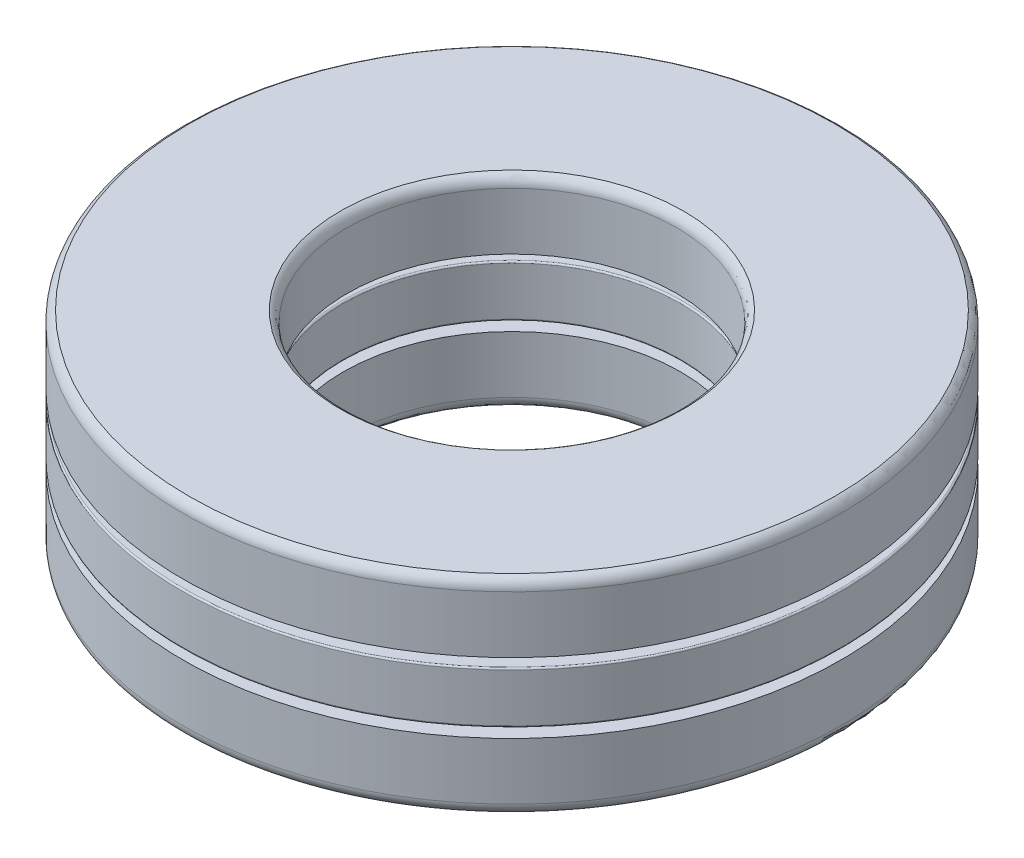
from build123d import *

# Parameters (mm, degrees)
CIRPATTERN1_COUNT = 10
CIRPATTERN2_COUNT = 10


# Read off the part's stored shape, not the designer's step: Cut-Revolve1
with BuildPart() as part:
    # Sketch3 → Revolve1 (revolve)
    with BuildSketch(Plane(origin=(0, 0, 0), x_dir=(0, 0, -1), z_dir=(1, 0, 0))):
        with BuildLine():
            Line((8, 0.85), (7.24012867, 0.85))
            ThreePointArc((7.24012867, 0.85), (6.05, 1.4625), (4.85987133, 0.85))
            Line((4.85987133, 0.85), (4, 0.85))
            Line((4, 0.85), (4, 2.232091434))
            ThreePointArc((4, 2.232091434), (4.044559205, 2.389412761), (4.165, 2.5))
            Line((4.165, 2.5), (7.835, 2.5))
            ThreePointArc((7.835, 2.5), (7.955440795, 2.389412761), (8, 2.232091434))
            Line((8, 2.232091434), (8, 0.85))
        make_face()
        with BuildLine():
            Line((4.85987133, -0.85), (4.1, -0.85))
            Line((4.1, -0.85), (4.1, -2.232091434))
            ThreePointArc((4.1, -2.232091434), (4.144559205, -2.389412761), (4.265, -2.5))
            Line((4.265, -2.5), (7.835, -2.5))
            ThreePointArc((7.835, -2.5), (7.955440795, -2.389412761), (8, -2.232091434))
            Line((8, -2.232091434), (8, -0.85))
            Line((8, -0.85), (7.24012867, -0.85))
            ThreePointArc((7.24012867, -0.85), (6.05, -1.4625), (4.85987133, -0.85))
        make_face()
        with BuildLine():
            Line((7.9625, 0.625), (4.1375, 0.625))
            ThreePointArc((4.1375, 0.625), (4.110983496, 0.614016504), (4.1, 0.5875))
            Line((4.1, 0.5875), (4.1, -0.5875))
            ThreePointArc((4.1, -0.5875), (4.110983496, -0.614016504), (4.1375, -0.625))
            Line((4.1375, -0.625), (7.9625, -0.625))
            ThreePointArc((7.9625, -0.625), (7.989016504, -0.614016504), (8, -0.5875))
            Line((8, -0.5875), (8, 0.5875))
            ThreePointArc((8, 0.5875), (7.989016504, 0.614016504), (7.9625, 0.625))
        make_face()
    revolve(axis=Axis((0, -2.5, 0), (0, 1, 0)))

    # Cut-Revolve1 outline → Cut-Revolve1 (revolve, cut)
    with BuildSketch(Plane.XY.offset(-6.05)):
        with BuildLine():
            Line((1.402682836, 0.625000001), (0, 0.625000001))
            Line((0, 0.625000001), (0, -0.625000001))
            Line((0, -0.625000001), (1.402682836, -0.625000001))
            ThreePointArc((1.402682836, -0.625000001), (1.535625, 0), (1.402682836, 0.625000001))
        make_face()
    cut_revolve1 = revolve(axis=Axis((0, 0, -6.05), (0, 1, 0)), mode=Mode.SUBTRACT)

    # CirPattern2: Cut-Revolve1 ×10 about axis
    cirpattern2_axis = Axis((0, 0, 0), (0, 1, 0))
    for i in range(1, CIRPATTERN2_COUNT):
        add(cut_revolve1.rotate(cirpattern2_axis, i * 360 / CIRPATTERN2_COUNT), mode=Mode.SUBTRACT)


with BuildPart() as body_2:
    # Sketch4 → Revolve2 (revolve)
    with BuildSketch(Plane(origin=(0, 0, 0), x_dir=(0, 0, -1), z_dir=(1, 0, 0))):
        with BuildLine():
            Line((6.05, -1.4625), (6.05, 1.4625))
            ThreePointArc((6.05, 1.4625), (4.5875, 0), (6.05, -1.4625))
        make_face()
    revolve(axis=Axis((0, 2.5, -6.05), (0, -1, 0)))


with BuildPart() as cirpattern1_1:
    # CirPattern1: pattern copy
    add(body_2.part.rotate(Axis((0, 0, 0), (0, 1, 0)), 1 * 360 / CIRPATTERN1_COUNT))


with BuildPart() as cirpattern1_2:
    # CirPattern1: pattern copy
    add(body_2.part.rotate(Axis((0, 0, 0), (0, 1, 0)), 2 * 360 / CIRPATTERN1_COUNT))


with BuildPart() as cirpattern1_3:
    # CirPattern1: pattern copy
    add(body_2.part.rotate(Axis((0, 0, 0), (0, 1, 0)), 3 * 360 / CIRPATTERN1_COUNT))


with BuildPart() as cirpattern1_4:
    # CirPattern1: pattern copy
    add(body_2.part.rotate(Axis((0, 0, 0), (0, 1, 0)), 4 * 360 / CIRPATTERN1_COUNT))


with BuildPart() as cirpattern1_5:
    # CirPattern1: pattern copy
    add(body_2.part.rotate(Axis((0, 0, 0), (0, 1, 0)), 5 * 360 / CIRPATTERN1_COUNT))


with BuildPart() as cirpattern1_6:
    # CirPattern1: pattern copy
    add(body_2.part.rotate(Axis((0, 0, 0), (0, 1, 0)), 6 * 360 / CIRPATTERN1_COUNT))


with BuildPart() as cirpattern1_7:
    # CirPattern1: pattern copy
    add(body_2.part.rotate(Axis((0, 0, 0), (0, 1, 0)), 7 * 360 / CIRPATTERN1_COUNT))


with BuildPart() as cirpattern1_8:
    # CirPattern1: pattern copy
    add(body_2.part.rotate(Axis((0, 0, 0), (0, 1, 0)), 8 * 360 / CIRPATTERN1_COUNT))


with BuildPart() as cirpattern1_9:
    # CirPattern1: pattern copy
    add(body_2.part.rotate(Axis((0, 0, 0), (0, 1, 0)), 9 * 360 / CIRPATTERN1_COUNT))


solid = Compound([part.part, body_2.part, cirpattern1_1.part, cirpattern1_2.part, cirpattern1_3.part, cirpattern1_4.part, cirpattern1_5.part, cirpattern1_6.part, cirpattern1_7.part, cirpattern1_8.part, cirpattern1_9.part])
